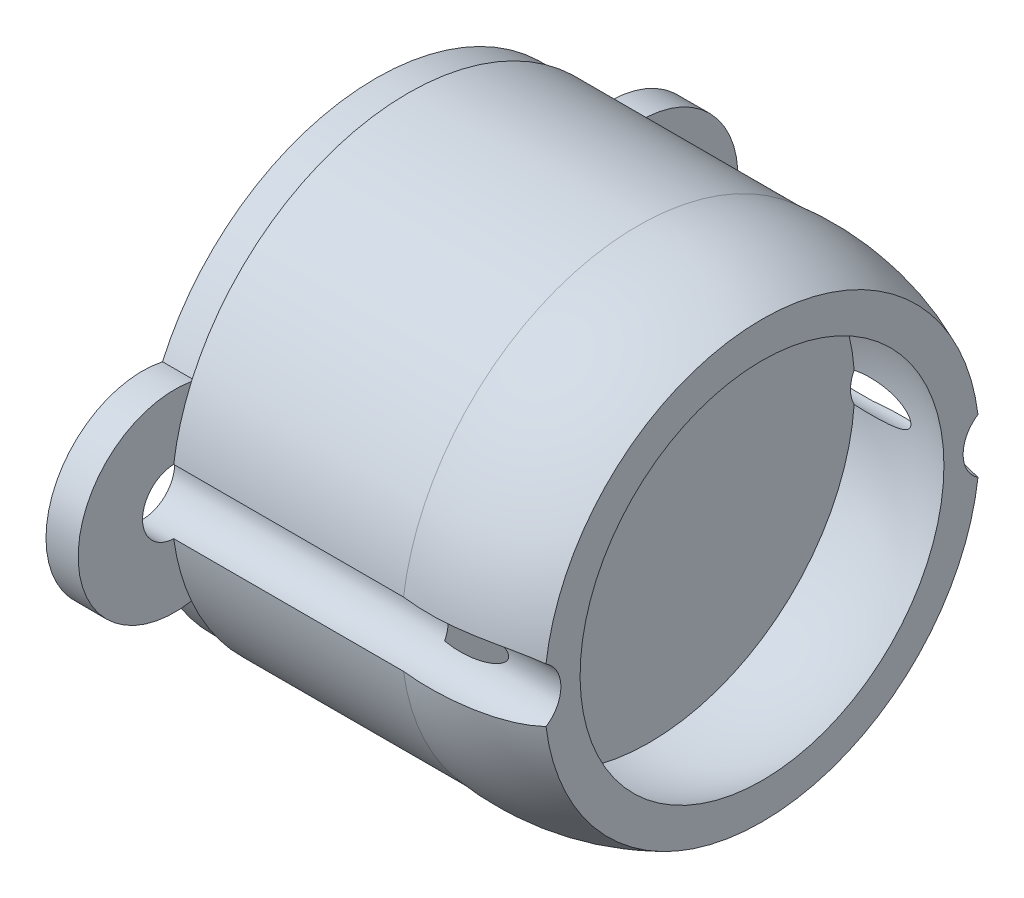
from build123d import *

# Parameters (mm, degrees)
ENL_V_START             = 3
ESQUISSE2_W             = 20.168692272
ESQUISSE2_H             = 19.901202985
ENL_V_MAT_EXTRU_1_DEPTH = 10
BOSS_EXTRU_1_START      = -11
ESQUISSE3_R             = 7.25
BOSS_EXTRU_1_DEPTH      = 1
ESQUISSE4_R             = 7.35
BOSS_EXTRU_2_DEPTH      = 7.5
ESQUISSE5_R             = 3
ESQUISSE5_R_2           = 1
BOSS_EXTRU_3_DEPTH      = 1
ESQUISSE6_R             = 1
ENL_V_MAT_EXTRU_2_DEPTH = 18.430504869


with BuildPart() as part:
    # Esquisse1 → Révolution1 (revolve)
    with BuildSketch(Plane.XY):
        with BuildLine():
            ThreePointArc((-6.4, 0), (0, 6.4), (6.4, 0))
            Line((6.4, 0), (7.4, 0))
            ThreePointArc((7.4, 0), (0, 7.4), (-7.4, 0))
            Line((-7.4, 0), (-6.4, 0))
        make_face()
    revolve(axis=Axis((-7.4, 0, 0), (1, 0, 0)))

    # Esquisse2 → Enlèv. mat.-Extru.1 (cut)
    with BuildSketch(Plane(origin=(0, 0, 0), x_dir=(0, 0, -1), z_dir=(1, 0, 0)).offset(ENL_V_START)):
        with Locations((-0.294238216, 0.080246787)):
            Rectangle(ESQUISSE2_W, ESQUISSE2_H)
    extrude(amount=ENL_V_MAT_EXTRU_1_DEPTH, mode=Mode.SUBTRACT)



with BuildPart() as body_2:
    # Esquisse3 → Boss.-Extru.1 (new body)
    with BuildSketch(Plane(origin=(3, 0, 0), x_dir=(0, 0, -1), z_dir=(1, 0, 0)).offset(BOSS_EXTRU_1_START)):
        Circle(ESQUISSE3_R)
    extrude(amount=-BOSS_EXTRU_1_DEPTH)


with BuildPart() as part_1:
    add(part.part)

    add(body_2.part)  # Boss.-Extru.2 merges body 2
    # Esquisse4 → Boss.-Extru.2 (add)
    with BuildSketch(Plane(origin=(-8, 0, 0), x_dir=(0, 0, -1), z_dir=(1, 0, 0))):
        Circle(ESQUISSE4_R)
    extrude(amount=BOSS_EXTRU_2_DEPTH)

    # Esquisse5 → Boss.-Extru.3 (add)
    # profile 1 of 2: a face of its own
    with BuildSketch(Plane.ZY.offset(9)):
        with Locations((7.25, 0)):
            Circle(ESQUISSE5_R)
        with Locations((7.25, 0)):
            Circle(ESQUISSE5_R_2, mode=Mode.SUBTRACT)
    # profile 2 of 2: a face of its own
    with BuildSketch(Plane.ZY.offset(9)):
        with Locations((-7.25, 0)):
            Circle(ESQUISSE5_R)
        with Locations((-7.25, 0)):
            Circle(ESQUISSE5_R_2, mode=Mode.SUBTRACT)
    extrude(amount=-BOSS_EXTRU_3_DEPTH)

    # Esquisse6 → Enlèv. mat.-Extru.2 (cut, through all)
    with BuildSketch(Plane.ZY.offset(9)):
        with Locations((-7.25, 0)):
            Circle(ESQUISSE6_R)
        with Locations((7.25, 0)):
            Circle(ESQUISSE6_R)
    extrude(amount=-ENL_V_MAT_EXTRU_2_DEPTH, mode=Mode.SUBTRACT)


solid = part_1.part
